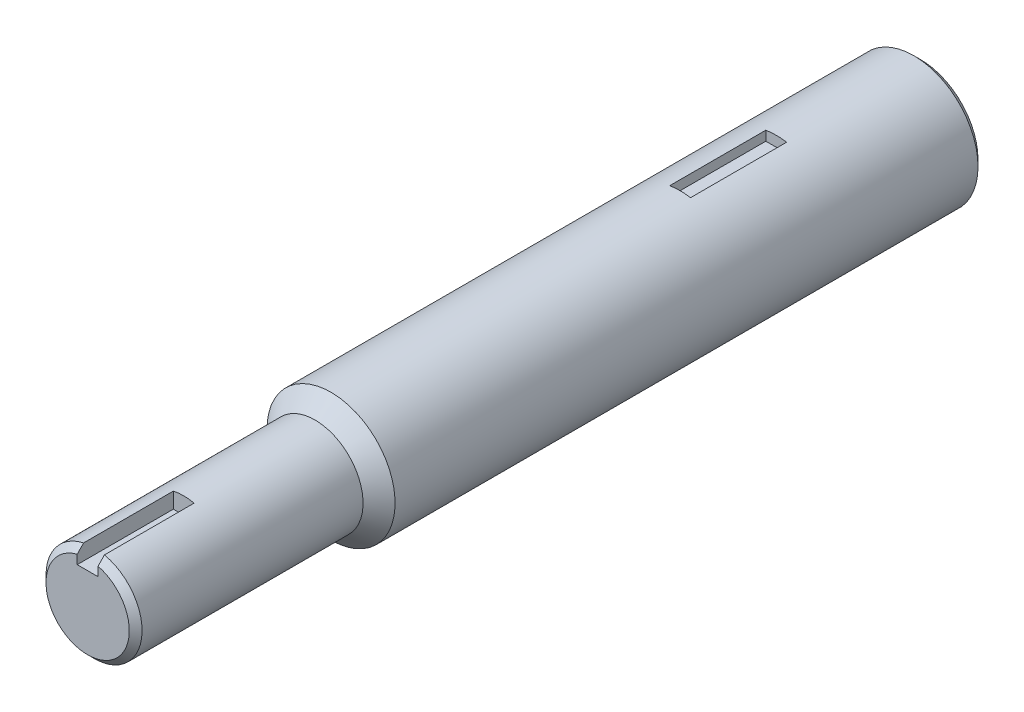
from build123d import *

# Parameters (mm, degrees)
CHAMFER1_SIZE      = 1
SKETCH3_W          = 3.25
SKETCH3_H          = 3.25
CUT_EXTRUDE2_DEPTH = 15
SKETCH4_W          = 3.25
SKETCH4_H          = 3.25
CUT_EXTRUDE3_DEPTH = 15
CHAMFER2_SIZE      = 3


with BuildPart() as part:
    # Sketch1 → Revolve1 (revolve)
    with BuildSketch(Plane(origin=(0, 0, 0), x_dir=(1, 0, 0), z_dir=(0, 1, 0)), mode=Mode.PRIVATE) as revolve1_sk:
        Polygon((10, 35), (7.5, 35), (7.5, 0), (0, 0), (0, 130), (10, 130), align=None)
    revolve(revolve1_sk.sketch.rotate(Axis((0, 0, -130), (0, 0, 1)), 180), axis=Axis((0, 0, -130), (0, 0, 1)))

    # Chamfer1
    chamfer1_edges = [part.edges().sort_by_distance(p)[0] for p in [
        (7.5, 0, 0),
        (10, 0, -130),
    ]]
    chamfer(chamfer1_edges, length=CHAMFER1_SIZE)

    # Sketch3 → Cut-Extrude2 (cut)
    with BuildSketch(Plane(origin=(0, 0, -107.5), x_dir=(-1, 0, 0), z_dir=(0, 0, -1))):
        with Locations((0, 10)):
            Rectangle(SKETCH3_W, SKETCH3_H)
    extrude(amount=-CUT_EXTRUDE2_DEPTH, mode=Mode.SUBTRACT)

    # Sketch4 → Cut-Extrude3 (cut)
    with BuildSketch(Plane.XY):
        with Locations((0, 6.5)):
            Rectangle(SKETCH4_W, SKETCH4_H)
    extrude(amount=-CUT_EXTRUDE3_DEPTH, mode=Mode.SUBTRACT)

    # Chamfer2
    # the kernel refuses this chamfer: 3 mm, written as the material it takes off along each edge
    with BuildSketch(Plane(origin=(0, 0, -35), x_dir=(-1, 0, 0), z_dir=(0, 1, 0))) as chamfer2_piece_1_section:
        Polygon((10 - CHAMFER2_SIZE, 0), (10, -CHAMFER2_SIZE), (10, 0), align=None)
    chamfer2_piece_1 = revolve(axis=Axis((0, 0, -35), (0, 0, 1)), mode=Mode.PRIVATE)
    chamfer2_piece_1 = chamfer2_piece_1 - Plane(origin=(0, 0, -36.746638668), x_dir=(-1, 0, 0), z_dir=(0, 0, 1)) * Cylinder(7.5, 41, mode=Mode.PRIVATE)
    add(chamfer2_piece_1, mode=Mode.SUBTRACT)


solid = part.part
